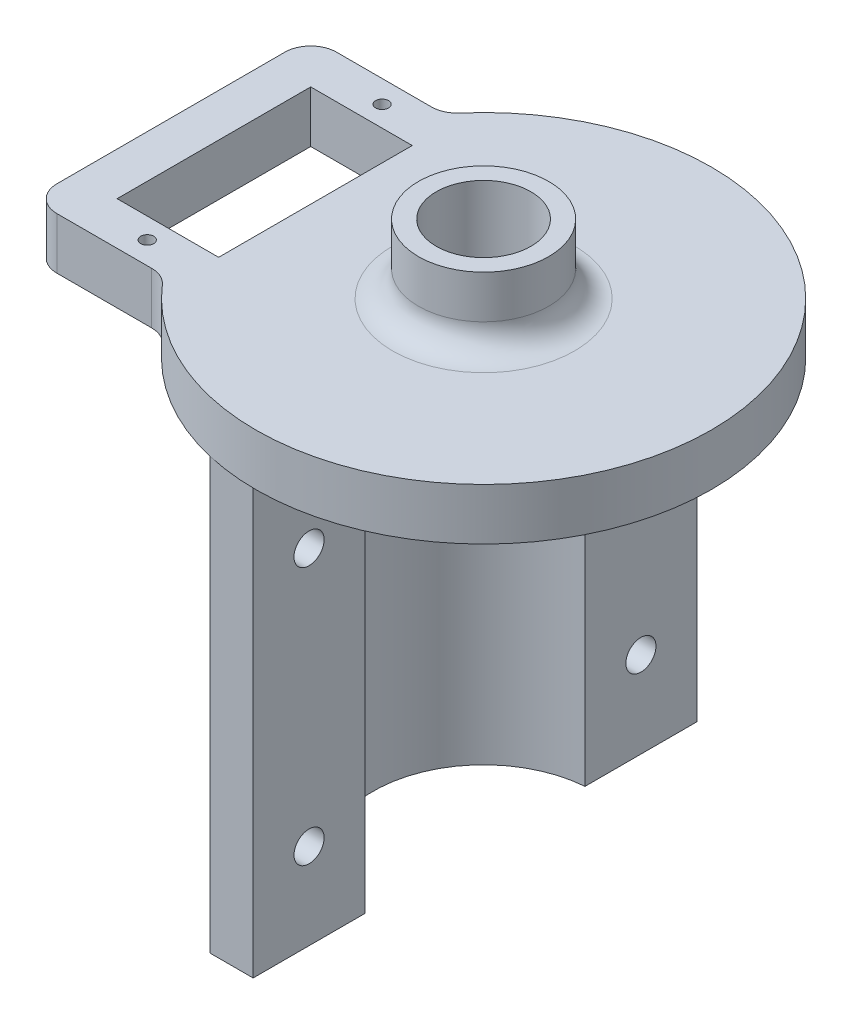
from build123d import *

# Parameters (mm, degrees)
BOSS_EXTRUDE4_DEPTH = 50
SKETCH7_R           = 1.75
CUT_EXTRUDE1_DEPTH  = 59.719147195
SKETCH8_R           = 0.75
SKETCH8_W           = 11.8
SKETCH8_H           = 22.5
BOSS_EXTRUDE5_DEPTH = 6
SKETCH9_R           = 7.57
BOSS_EXTRUDE6_DEPTH = 8
FILLET1_R           = 3
SKETCH10_R          = 5.5
CUT_EXTRUDE2_DEPTH  = 79.215829027


with BuildPart() as part:
    # Sketch6 → Boss-Extrude4 (new body)
    with BuildSketch(Plane.XZ):
        with BuildLine():
            Line((-1, 25.784833184), (-1, 12.785954208))
            ThreePointArc((-1, 12.785954208), (-12.825, 0), (-1, -12.785954208))
            Line((-1, -12.785954208), (-1, -25.784833184))
            Line((-1, -25.784833184), (-6, -25.784833184))
            Line((-6, -25.784833184), (-6, -16.784833184))
            ThreePointArc((-6, -16.784833184), (-17.825, 0), (-6, 16.784833184))
            Line((-6, 16.784833184), (-6, 25.784833184))
            Line((-6, 25.784833184), (-1, 25.784833184))
        make_face()
    extrude(amount=BOSS_EXTRUDE4_DEPTH)

    # Sketch7 → Cut-Extrude1 (cut, through all)
    with BuildSketch(Plane(origin=(-1, 0, 0), x_dir=(0, 0, -1), z_dir=(1, 0, 0))):
        with Locations((-19.285393696, -10)):
            Circle(SKETCH7_R)
        with Locations((-19.285393696, -40)):
            Circle(SKETCH7_R)
        with Locations((19.285393696, -40)):
            Circle(SKETCH7_R)
        with Locations((19.285393696, -10)):
            Circle(SKETCH7_R)
    extrude(amount=-CUT_EXTRUDE1_DEPTH, mode=Mode.SUBTRACT)

    # Sketch8 → Boss-Extrude5 (add)
    with BuildSketch(Plane(origin=(0, 0, 0), x_dir=(1, 0, 0), z_dir=(0, 1, 0))):
        with BuildLine():
            Line((-33.34361413, -16.25), (-22.318992281, -16.25))
            ThreePointArc((-22.318992281, -16.25), (-21.069616181, -16.522536094), (-20.047240136, -17.290627093))
            ThreePointArc((-20.047240136, -17.290627093), (26.473715688, 0), (-20.047240136, 17.290627093))
            ThreePointArc((-20.047240136, 17.290627093), (-21.069616181, 16.522536094), (-22.318992281, 16.25))
            Line((-22.318992281, 16.25), (-33.34361413, 16.25))
            ThreePointArc((-33.34361413, 16.25), (-35.464934474, 15.371320344), (-36.34361413, 13.25))
            Line((-36.34361413, 13.25), (-36.34361413, -13.25))
            ThreePointArc((-36.34361413, -13.25), (-35.464934474, -15.371320344), (-33.34361413, -16.25))
        make_face()
        with Locations((-25.44361413, 13.65)):
            Circle(SKETCH8_R, mode=Mode.SUBTRACT)
        with Locations((-25.44361413, -13.65)):
            Circle(SKETCH8_R, mode=Mode.SUBTRACT)
        with Locations((-25.44361413, 0)):
            Rectangle(SKETCH8_W, SKETCH8_H, mode=Mode.SUBTRACT)
    extrude(amount=BOSS_EXTRUDE5_DEPTH)

    # Sketch9 → Boss-Extrude6 (add)
    with BuildSketch(Plane(origin=(0, 6, 0), x_dir=(1, 0, 0), z_dir=(0, 1, 0))):
        Circle(SKETCH9_R)
    extrude(amount=BOSS_EXTRUDE6_DEPTH)

    # Fillet1
    fillet1_edges = [part.edges().sort_by_distance(p)[0] for p in [
        (-7.57, 6, 0),
    ]]
    fillet(fillet1_edges, radius=FILLET1_R)

    # Sketch10 → Cut-Extrude2 (cut, through all)
    with BuildSketch(Plane(origin=(0, 14, 0), x_dir=(1, 0, 0), z_dir=(0, 1, 0))):
        Circle(SKETCH10_R)
    extrude(amount=-CUT_EXTRUDE2_DEPTH, mode=Mode.SUBTRACT)


solid = part.part
